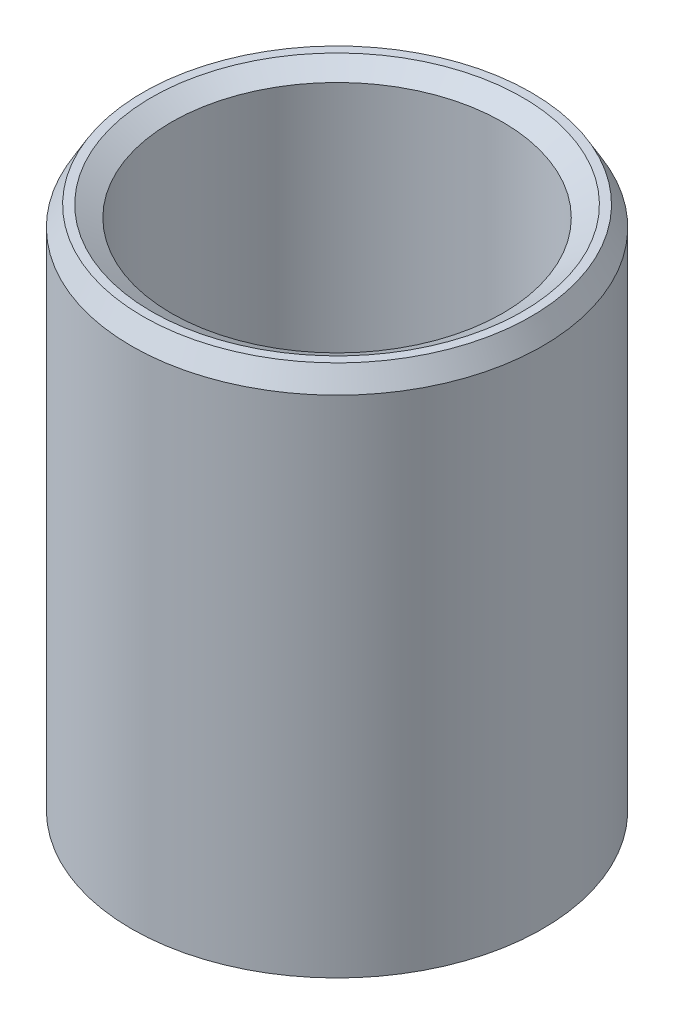
from build123d import *
from OCP.BRepFilletAPI import BRepFilletAPI_MakeChamfer

# Parameters (mm, degrees)
SKETCH1_R           = 35
BOSS_EXTRUDE1_DEPTH = 91.267133939
SKETCH2_R           = 28.202285635
CUT_EXTRUDE1_DEPTH  = 104.825284673
CHAMFER1_SIZE       = 3.383591781
CHAMFER1_SIZE2      = 1.953517626


with BuildPart() as part:
    # Sketch1 → Boss-Extrude1 (new body)
    with BuildSketch(Plane(origin=(0, 0, 0), x_dir=(1, 0, 0), z_dir=(0, 1, 0))):
        Circle(SKETCH1_R)
    extrude(amount=BOSS_EXTRUDE1_DEPTH)

    # Sketch2 → Cut-Extrude1 (cut, through all)
    with BuildSketch(Plane(origin=(0, 0, 0), x_dir=(1, 0, 0), z_dir=(0, 1, 0))):
        Circle(SKETCH2_R)
    extrude(amount=CUT_EXTRUDE1_DEPTH, mode=Mode.SUBTRACT)

    # Chamfer1: one chamfer whose edges measure the first distance from different faces: ONE call of the kernel's chamfer builder (chamfer() names one face for all edges)
    chamfer1_edges_1 = [part.edges().sort_by_distance(p)[0] for p in [
        (-28.202285635, 91.267133939, 0),
    ]]
    chamfer1_side_1 = [part.faces().sort_by_distance(p)[0] for p in [
        (-34.010050506, 91.267133939, 0),
    ]]
    chamfer1_edges_2 = [part.edges().sort_by_distance(p)[0] for p in [
        (-28.202285635, 0, 0),
    ]]
    chamfer1_side_2 = [part.faces().sort_by_distance(p)[0] for p in [
        (-28.202285635, 45.63356697, 0),
    ]]
    chamfer1_edges_3 = [part.edges().sort_by_distance(p)[0] for p in [
        (-35, 0, 0),
    ]]
    chamfer1_side_3 = [part.faces().sort_by_distance(p)[0] for p in [
        (-34.010050506, 0, 0),
    ]]
    chamfer1_edges_4 = [part.edges().sort_by_distance(p)[0] for p in [
        (-35, 91.267133939, 0),
    ]]
    chamfer1_side_4 = [part.faces().sort_by_distance(p)[0] for p in [
        (-35, 45.63356697, 0),
    ]]
    chamfer1 = BRepFilletAPI_MakeChamfer(part.part.solid().wrapped)
    for e in chamfer1_edges_1:
        chamfer1.Add(CHAMFER1_SIZE, CHAMFER1_SIZE2, e.wrapped, chamfer1_side_1[0].wrapped)  # the first distance lies on this face
    for e in chamfer1_edges_2:
        chamfer1.Add(CHAMFER1_SIZE, CHAMFER1_SIZE2, e.wrapped, chamfer1_side_2[0].wrapped)  # the first distance lies on this face
    for e in chamfer1_edges_3:
        chamfer1.Add(CHAMFER1_SIZE, CHAMFER1_SIZE2, e.wrapped, chamfer1_side_3[0].wrapped)  # the first distance lies on this face
    for e in chamfer1_edges_4:
        chamfer1.Add(CHAMFER1_SIZE, CHAMFER1_SIZE2, e.wrapped, chamfer1_side_4[0].wrapped)  # the first distance lies on this face
    add(Compound.cast(chamfer1.Shape()), mode=Mode.REPLACE)


solid = part.part
